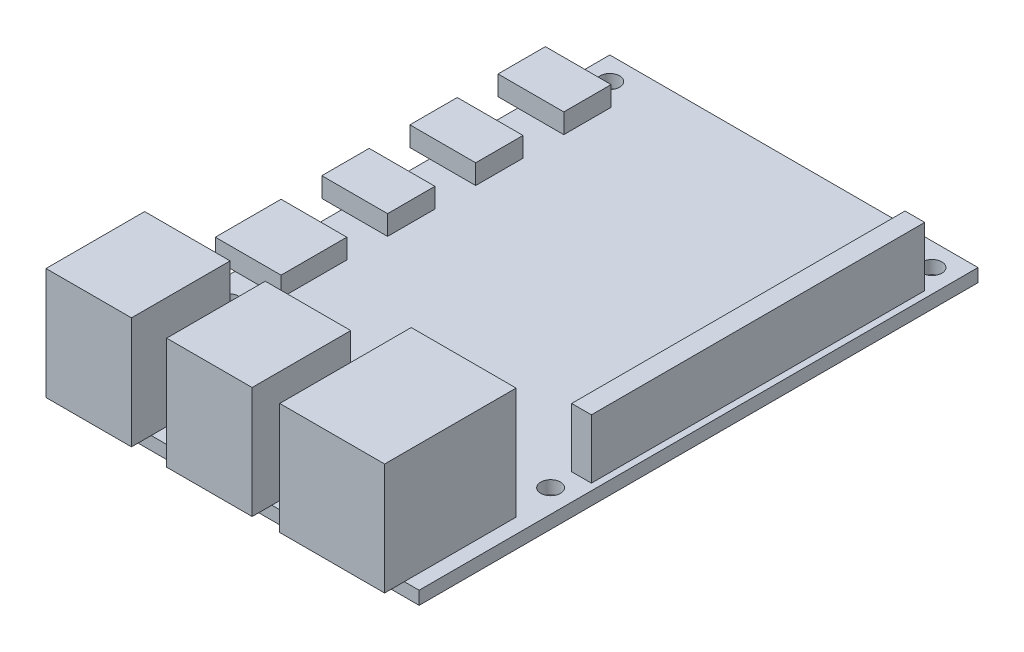
from build123d import *

# Parameters (mm, degrees)
SKETCH1_W           = 56
SKETCH1_H           = 85
SKETCH1_R           = 1.5
BOSS_EXTRUDE1_DEPTH = 2
SKETCH2_W           = 3
SKETCH2_H           = 50.7
BOSS_EXTRUDE2_DEPTH = 9
SKETCH3_W           = 13
SKETCH3_H           = 15
SKETCH3_W_2         = 15.95
SKETCH3_H_2         = 20
BOSS_EXTRUDE3_DEPTH = 17
SKETCH4_W           = 10
SKETCH4_H           = 7.2
SKETCH4_H_2         = 10
BOSS_EXTRUDE4_DEPTH = 3


with BuildPart() as part:
    # Sketch1 → Boss-Extrude1 (new body)
    with BuildSketch(Plane(origin=(0, 0, 0), x_dir=(1, 0, 0), z_dir=(0, 1, 0))):
        Rectangle(SKETCH1_W, SKETCH1_H)
        with Locations((-24.5, 39)):
            Circle(SKETCH1_R, mode=Mode.SUBTRACT)
        with Locations((24.5, 39)):
            Circle(SKETCH1_R, mode=Mode.SUBTRACT)
        with Locations((-24.5, -19)):
            Circle(SKETCH1_R, mode=Mode.SUBTRACT)
        with Locations((24.5, -19)):
            Circle(SKETCH1_R, mode=Mode.SUBTRACT)
    extrude(amount=BOSS_EXTRUDE1_DEPTH)

    # Sketch2 → Boss-Extrude2 (add)
    with BuildSketch(Plane(origin=(0, 2, 0), x_dir=(1, 0, 0), z_dir=(0, 1, 0))):
        with Locations((25.5, 10.05)):
            Rectangle(SKETCH2_W, SKETCH2_H)
    extrude(amount=BOSS_EXTRUDE2_DEPTH)

    # Sketch3 → Boss-Extrude3 (add)
    with BuildSketch(Plane(origin=(0, 2, 0), x_dir=(1, 0, 0), z_dir=(0, 1, 0))):
        with Locations((-19.25, -38)):
            Rectangle(SKETCH3_W, SKETCH3_H)
        with Locations((-0.9, -38)):
            Rectangle(SKETCH3_W, SKETCH3_H)
        with Locations((17.775, -35.5)):
            Rectangle(SKETCH3_W_2, SKETCH3_H_2)
    extrude(amount=BOSS_EXTRUDE3_DEPTH)

    # Sketch4 → Boss-Extrude4 (add)
    with BuildSketch(Plane(origin=(0, 2, 0), x_dir=(1, 0, 0), z_dir=(0, 1, 0))):
        with Locations((-26, 32.1)):
            Rectangle(SKETCH4_W, SKETCH4_H)
        with Locations((-26, 5.3)):
            Rectangle(SKETCH4_W, SKETCH4_H)
        with Locations((-26, -9.5)):
            Rectangle(SKETCH4_W, SKETCH4_H_2)
        with Locations((-26, 18.7)):
            Rectangle(SKETCH4_W, SKETCH4_H)
    extrude(amount=BOSS_EXTRUDE4_DEPTH)


solid = part.part
